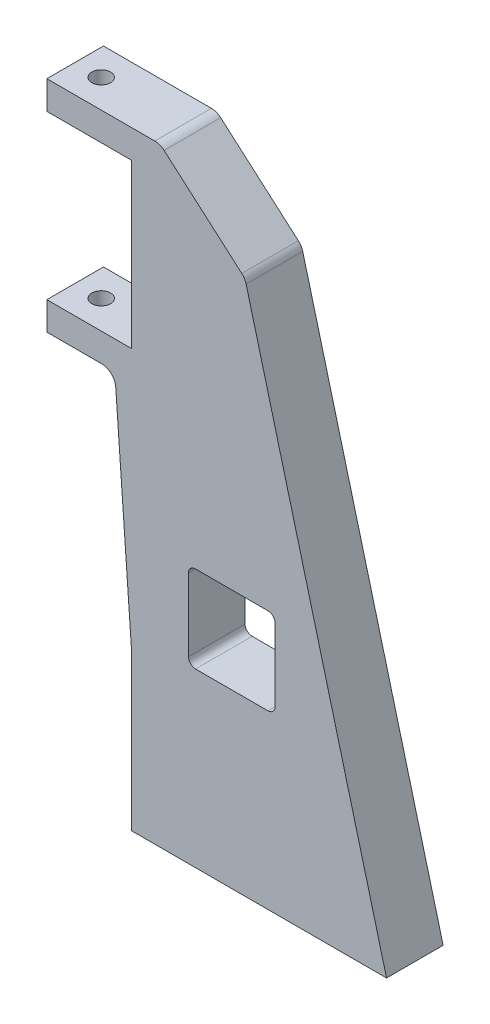
from build123d import *

# Parameters (mm, degrees)
BOSS_EXTRUDE1_DEPTH = 25.4
SKETCH2_W           = 38.862
SKETCH2_H           = 38.862
CUT_EXTRUDE1_DEPTH  = 303.885239179
FILLET1_R           = 6.35
FILLET2_R           = 3.175
SKETCH3_R           = 4.191
CUT_EXTRUDE2_DEPTH  = 314.875552812
SKETCH4_R           = 4.191
CUT_EXTRUDE3_DEPTH  = 25.4


with BuildPart() as part:
    # Sketch1 → Boss-Extrude1 (new body)
    with BuildSketch(Plane.XY):
        Polygon((0, 0), (0, 12.7), (50.8, 12.7), (88.9, -20.510228633), (152.4, -260.515926793), (38.018659419, -260.515926793), (38.018659419, -190.696503564), (30.48, -85.763926793), (0, -85.763926793), (0, -73.152260366), (38.018659419, -73.152260366), (38.018659419, 0), align=None)
    extrude(amount=BOSS_EXTRUDE1_DEPTH)

    # Sketch2 → Cut-Extrude1 (cut, through all)
    with BuildSketch(Plane(origin=(0, 0, 0), x_dir=(-1, 0, 0), z_dir=(0, 0, -1))):
        with Locations((-82.955564704, -163.868926793)):
            Rectangle(SKETCH2_W, SKETCH2_H)
    extrude(amount=-CUT_EXTRUDE1_DEPTH, mode=Mode.SUBTRACT)

    # Fillet1
    # the kernel refuses this fillet: 6.35 mm, written as the material it adds along each edge
    with BuildSketch(Plane(origin=(38.018659419, -190.696503564, 0), x_dir=(0, -1, 0), z_dir=(0, 0, 1))) as fillet1_piece_1:
        with BuildLine():
            CenterArc((FILLET1_R * 0.0358752122725, -FILLET1_R), FILLET1_R, 90, 4.109234206)
            Line((-FILLET1_R * 0.0357829859603, -FILLET1_R * 0.00257075307266), (0, 0))
            Line((0, 0), (FILLET1_R * 0.0358752122725, 0))
        make_face()
    extrude(amount=25.4)
    with BuildSketch(Plane(origin=(30.48, -85.763926793, 0), x_dir=(-1, 0, 0), z_dir=(0, 0, 1))) as fillet1_piece_2:
        with BuildLine():
            CenterArc((FILLET1_R * 0.930734490318, FILLET1_R), FILLET1_R, 184.109234206, 85.890765794)
            Line((-FILLET1_R * 0.0666947566093, FILLET1_R * 0.928341801767), (0, 0))
            Line((0, 0), (FILLET1_R * 0.930734490318, 0))
        make_face()
    extrude(amount=25.4)
    # the kernel refuses this fillet: 6.35 mm, written as the material it takes off along each edge
    with BuildSketch(Plane(origin=(50.8, 12.7, -5.947635314), x_dir=(-1, 0, 0), z_dir=(0, 0, 1))) as fillet1_2_piece_1:
        with BuildLine():
            CenterArc((FILLET1_R * 0.374654193004, FILLET1_R), FILLET1_R, 228.922654606, 41.077345394)
            Line((-FILLET1_R * 0.282423044355, FILLET1_R * 0.246176742103), (0, 0))
            Line((0, 0), (FILLET1_R * 0.374654193004, 0))
        make_face()
    extrude(amount=37.295270628, mode=Mode.SUBTRACT)
    with BuildSketch(Plane(origin=(88.9, -20.510228633, -4.869092834), x_dir=(-0.7538232578965339, 0.6570772373581782, 0), z_dir=(0, 0, 1))) as fillet1_2_piece_2:
        with BuildLine():
            CenterArc((FILLET1_R * 0.306714509228, FILLET1_R), FILLET1_R, 235.896927034, 34.103072966)
            Line((-FILLET1_R * 0.253968896194, FILLET1_R * 0.171969735526), (0, 0))
            Line((0, 0), (FILLET1_R * 0.306714509228, 0))
        make_face()
    extrude(amount=35.138185668, mode=Mode.SUBTRACT)

    # Fillet2
    fillet2_edges = [part.edges().sort_by_distance(p)[0] for p in [
        (63.524564704, -144.437926793, 12.7),
        (63.524564704, -183.299926793, 12.7),
        (102.386564704, -183.299926793, 12.7),
        (102.386564704, -144.437926793, 12.7),
    ]]
    fillet(fillet2_edges, radius=FILLET2_R)

    # Sketch3 → Cut-Extrude2 (cut, through all)
    with BuildSketch(Plane(origin=(0, 12.7, 0), x_dir=(1, 0, 0), z_dir=(0, 1, 0))):
        with Locations(Location((11.684, -12.7, 0), (0, 0, 270))):
            Circle(SKETCH3_R)
    extrude(amount=-CUT_EXTRUDE2_DEPTH, mode=Mode.SUBTRACT)

    # Sketch4 → Cut-Extrude3 (cut)
    with BuildSketch(Plane.XZ.offset(260.515926793)):
        with Locations((139.7, 12.7)):
            Circle(SKETCH4_R)
        with Locations((63.5, 12.7)):
            Circle(SKETCH4_R)
    extrude(amount=-CUT_EXTRUDE3_DEPTH, mode=Mode.SUBTRACT)


solid = part.part
